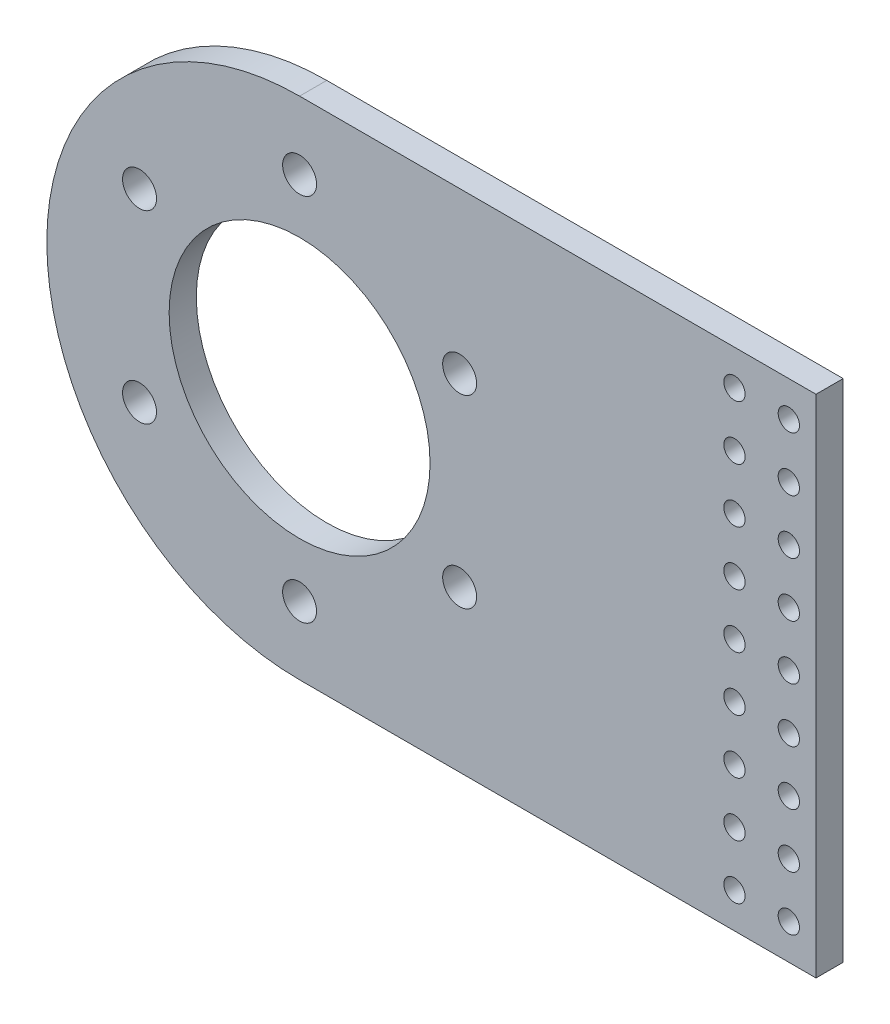
from build123d import *

# Parameters (mm, degrees)
SKETCH1_R                      = 30.48
BOSS_EXTRUDE1_DEPTH            = 6.35
F_9_0_196_DIAMETER_HOLE1_D     = 4.9784
F_5_16_0_3125_DIAMETER_HOLE1_D = 7.9375


with BuildPart() as part:
    # Sketch1 → Boss-Extrude1 (new body)
    with BuildSketch(Plane(origin=(0, 0, 0), x_dir=(0, 1, 0), z_dir=(0, 0, 1))):
        with BuildLine():
            Line((-59.055, 0), (-59.055, -120.65))
            Line((-59.055, -120.65), (59.055, -120.65))
            Line((59.055, -120.65), (59.055, 0))
            ThreePointArc((59.055, 0), (0, 59.055), (-59.055, 0))
        make_face()
        Circle(SKETCH1_R, mode=Mode.SUBTRACT)
    extrude(amount=BOSS_EXTRUDE1_DEPTH)

    # #9 (0.196) Diameter Hole1 (through all)
    with Locations(Plane.XY.offset(6.35)):
        with Locations((114.3, -50.8), (101.6, -50.8), (101.6, -38.1), (101.6, -25.4), (101.6, -12.7), (101.6, 0), (101.6, 12.7), (101.6, 25.4), (101.6, 38.1), (101.6, 50.8), (114.3, -38.1), (114.3, -25.4), (114.3, -12.7), (114.3, 0), (114.3, 12.7), (114.3, 25.4), (114.3, 38.1), (114.3, 50.8)):
            Hole(F_9_0_196_DIAMETER_HOLE1_D / 2)

    # 5/16 (0.3125) Diameter Hole1 (through all)
    with Locations(Plane.XY.offset(6.35)):
        with Locations((37.394976935, 21.59), (37.394976935, -21.59), (0, -43.18), (-37.394976935, -21.59), (-37.394976935, 21.59), (0, 43.18)):
            Hole(F_5_16_0_3125_DIAMETER_HOLE1_D / 2)


solid = part.part
